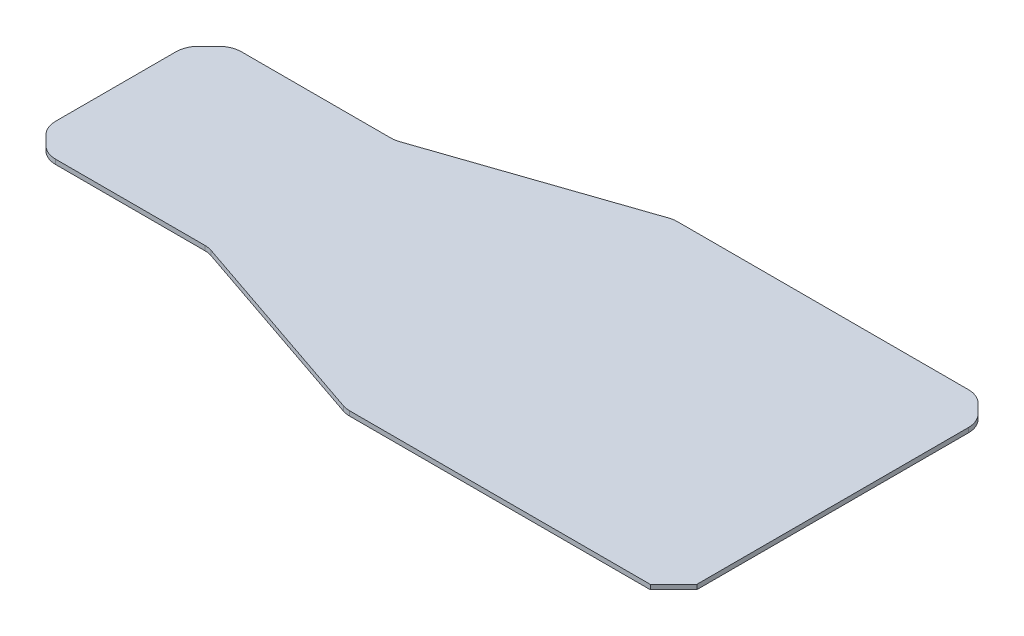
from build123d import *

# Parameters (mm, degrees)
BOSS_EXTRUDE1_DEPTH = 2
CHAMFER1_SIZE       = 10
FILLET1_R           = 10


with BuildPart() as part:
    # Sketch1 → Boss-Extrude1 (new body)
    with BuildSketch(Plane(origin=(0, 0, 0), x_dir=(1, 0, 0), z_dir=(0, 1, 0))):
        Polygon((40, 40), (129.5, 70.5), (270.5, 70.5), (270.5, -70.5), (129.5, -70.5), (40, -40), (-40, -40), (-40, 40), align=None)
    extrude(amount=BOSS_EXTRUDE1_DEPTH)

    # Chamfer1
    chamfer1_edges = [part.edges().sort_by_distance(p)[0] for p in [
        (-40, 1, -40),
        (270.5, 1, -70.5),
        (270.5, 1, 70.5),
        (-40, 1, 40),
    ]]
    chamfer(chamfer1_edges, length=CHAMFER1_SIZE)

    # Fillet1
    fillet1_edges = [part.edges().sort_by_distance(p)[0] for p in [
        (-30, 1, 40),
        (-40, 1, 30),
        (-30, 1, -40),
        (-40, 1, -30),
        (270.5, 1, -60.5),
        (260.5, 1, -70.5),
        (40, 1, 40),
        (129.5, 1, 70.5),
        (40, 1, -40),
        (129.5, 1, -70.5),
    ]]
    fillet(fillet1_edges, radius=FILLET1_R)


solid = part.part
